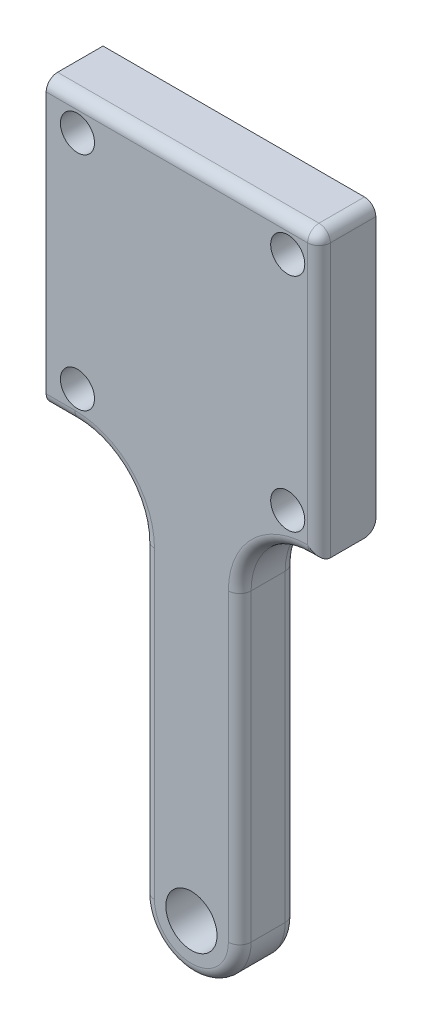
from build123d import *

# Parameters (mm, degrees)
CROQUIS1_R              = 2.2500000000000027
CROQUIS1_R_2            = 1.5000000000000013
CROQUIS1_R_3            = 1.5000000000000009
CROQUIS1_R_4            = 1.4999999999999967
SALIENTE_EXTRUIR1_DEPTH = 5
REDONDEO1_R             = 1


with BuildPart() as part:
    # Croquis1 → Saliente-Extruir1 (new body)
    with BuildSketch(Plane.XY):
        with BuildLine():
            Line((-2.100000000000147, 41.01261693614467), (21.89999999999985, 41.01261693614466))
            Line((21.89999999999985, 41.01261693614466), (21.89999999999985, 16.01261693614466))
            Line((21.89999999999985, 16.01261693614466), (20.92776114455846, 16.01261693614466))
            ThreePointArc((20.92776114455846, 16.01261693614466), (16.68512045743913, 14.255257623263944), (14.927761144558415, 10.012616936144616))
            Line((14.927761144558415, 10.012616936144616), (14.927761144558415, -16.751467205989318))
            ThreePointArc((14.927761144558415, -16.751467205989318), (10.677761144558414, -21.001467205989325), (6.427761144558411, -16.751467205989318))
            Line((6.427761144558411, -16.751467205989318), (6.427761144558411, 10.012616936144616))
            ThreePointArc((6.427761144558411, 10.012616936144616), (4.670401831677697, 14.255257623263944), (0.42776114455836833, 16.01261693614466))
            Line((0.42776114455836833, 16.01261693614466), (-2.100000000000148, 16.01261693614466))
            Line((-2.100000000000148, 16.01261693614466), (-2.100000000000147, 41.01261693614467))
        make_face()
        with Locations((10.677761144558414, -16.751467205989318)):
            Circle(CROQUIS1_R, mode=Mode.SUBTRACT)
        with Locations((0.6499999999998556, 38.26261693614465)):
            Circle(CROQUIS1_R_2, mode=Mode.SUBTRACT)
        with Locations((19.1499999999999, 38.26261693614465)):
            Circle(CROQUIS1_R_3, mode=Mode.SUBTRACT)
        with Locations((19.1499999999999, 18.76261693614465)):
            Circle(CROQUIS1_R_4, mode=Mode.SUBTRACT)
        with Locations((0.6499999999998556, 18.76261693614465)):
            Circle(CROQUIS1_R_2, mode=Mode.SUBTRACT)
    extrude(amount=SALIENTE_EXTRUIR1_DEPTH)

    # Redondeo1
    # the kernel refuses this fillet: 1 mm, written as the material it takes off along each edge
    with BuildSketch(Plane(origin=(20.89999999999985, 40.01261693614466, 4), x_dir=(3e-16, 1, 0), z_dir=(0, 0, 1))) as redondeo1_piece_1_section:
        Polygon((0, 0), (REDONDEO1_R, 0), (REDONDEO1_R, -REDONDEO1_R), (3e-16, -REDONDEO1_R), align=None)
    redondeo1_piece_1 = extrude(amount=REDONDEO1_R, mode=Mode.PRIVATE)
    redondeo1_piece_1 = redondeo1_piece_1 - Plane(origin=(20.89999999999985, 40.01261693614466, 4), x_dir=(-0.7071067811865477, -0.7071067811865475, 0), z_dir=(0, 0, 1)) * Sphere(REDONDEO1_R, mode=Mode.PRIVATE)
    add(redondeo1_piece_1, mode=Mode.SUBTRACT)
    with BuildSketch(Plane(origin=(0.42776114455836833, 16.01261693614466, 0), x_dir=(0, 0, 1), z_dir=(-1, 0, 0))) as redondeo1_piece_2:
        with BuildLine():
            CenterArc((REDONDEO1_R, REDONDEO1_R), REDONDEO1_R, 180, 90)
            Line((-1.1e-16, REDONDEO1_R), (0, 0))
            Line((0, 0), (REDONDEO1_R, 0))
        make_face()
    extrude(amount=5.027761144558516, mode=Mode.SUBTRACT)
    with BuildSketch(Plane(origin=(24.39999999999985, 16.01261693614466, 0), x_dir=(0, 0, 1), z_dir=(-1, 0, 0))) as redondeo1_piece_3:
        with BuildLine():
            CenterArc((REDONDEO1_R, REDONDEO1_R), REDONDEO1_R, 180, 90)
            Line((-1.1e-16, REDONDEO1_R), (0, 0))
            Line((0, 0), (REDONDEO1_R, 0))
        make_face()
    extrude(amount=3.4722388554413897, mode=Mode.SUBTRACT)
    with BuildSketch(Plane(origin=(20.927761144558417, 10.012616936144658, 0), x_dir=(7.11e-15, 1, 0), z_dir=(1, -7.11e-15, 0))) as redondeo1_piece_4:
        with BuildLine():
            CenterArc((6.000000000000002 + REDONDEO1_R, REDONDEO1_R), REDONDEO1_R, 180, 90)
            Line((6.000000000000002 + REDONDEO1_R, -1.1e-16), (6.000000000000002, 0))
            Line((6.000000000000002, 0), (6.000000000000002, REDONDEO1_R))
        make_face()
    revolve(axis=Axis((20.927761144558417, 10.012616936144658, 0), (0, 0, 1)), revolution_arc=90.00000000000081, mode=Mode.SUBTRACT)
    with BuildSketch(Plane(origin=(14.927761144558415, 10.012616936144616, 0), x_dir=(0, 0, 1), z_dir=(0, -1, 0))) as redondeo1_piece_5:
        with BuildLine():
            CenterArc((REDONDEO1_R, REDONDEO1_R), REDONDEO1_R, 180, 90)
            Line((-1.1e-16, REDONDEO1_R), (0, 0))
            Line((0, 0), (REDONDEO1_R, 0))
        make_face()
    extrude(amount=26.76408414213393, mode=Mode.SUBTRACT)
    with BuildSketch(Plane(origin=(10.677761144558414, -16.75146720598932, 0), x_dir=(1, 8.4e-16, 0), z_dir=(-8.4e-16, 1, 0))) as redondeo1_piece_6:
        with BuildLine():
            CenterArc((4.2500000000000036 - REDONDEO1_R, -REDONDEO1_R), REDONDEO1_R, 0, 90)
            Line((4.2500000000000036 - REDONDEO1_R, 1.1e-16), (4.2500000000000036, 0))
            Line((4.2500000000000036, 0), (4.2500000000000036, -REDONDEO1_R))
        make_face()
    revolve(axis=Axis((10.677761144558414, -16.75146720598932, 0), (0, 0, -1)), revolution_arc=180.0000000000001, mode=Mode.SUBTRACT)
    with BuildSketch(Plane(origin=(6.427761144558411, -16.751467205989318, 0), x_dir=(0, 0, 1), z_dir=(0, 1, 0))) as redondeo1_piece_7:
        with BuildLine():
            CenterArc((REDONDEO1_R, REDONDEO1_R), REDONDEO1_R, 180, 90)
            Line((-1.1e-16, REDONDEO1_R), (0, 0))
            Line((0, 0), (REDONDEO1_R, 0))
        make_face()
    extrude(amount=26.76408414213393, mode=Mode.SUBTRACT)
    with BuildSketch(Plane(origin=(0.42776114455836833, 16.01261693614466, 5), x_dir=(0, 0, -1), z_dir=(-1, 0, 0))) as redondeo1_piece_8:
        with BuildLine():
            CenterArc((REDONDEO1_R, -REDONDEO1_R), REDONDEO1_R, 90, 90)
            Line((0, -REDONDEO1_R), (0, 0))
            Line((0, 0), (REDONDEO1_R, 0))
        make_face()
    extrude(amount=5.027761144558516, mode=Mode.SUBTRACT)
    with BuildSketch(Plane(origin=(0.4277611445584084, 10.012616936144658, 5), x_dir=(1, -7.11e-15, 0), z_dir=(-7.11e-15, -1, 0))) as redondeo1_piece_9:
        with BuildLine():
            CenterArc((6.000000000000003 + REDONDEO1_R, -REDONDEO1_R), REDONDEO1_R, 90, 90)
            Line((6.000000000000003 + REDONDEO1_R, 0), (6.000000000000003, 0))
            Line((6.000000000000003, 0), (6.000000000000003, -REDONDEO1_R))
        make_face()
    revolve(axis=Axis((0.4277611445584084, 10.012616936144658, 5), (0, 0, 1)), revolution_arc=90.00000000000078, mode=Mode.SUBTRACT)
    with BuildSketch(Plane(origin=(20.927761144558417, 10.012616936144658, 5), x_dir=(7.11e-15, 1, 0), z_dir=(1, -7.11e-15, 0))) as redondeo1_piece_10:
        with BuildLine():
            CenterArc((6.000000000000002 + REDONDEO1_R, -REDONDEO1_R), REDONDEO1_R, 90, 90)
            Line((6.000000000000002 + REDONDEO1_R, 0), (6.000000000000002, 0))
            Line((6.000000000000002, 0), (6.000000000000002, -REDONDEO1_R))
        make_face()
    revolve(axis=Axis((20.927761144558417, 10.012616936144658, 5), (0, 0, 1)), revolution_arc=90.00000000000081, mode=Mode.SUBTRACT)
    with BuildSketch(Plane(origin=(14.927761144558415, 10.012616936144616, 5), x_dir=(0, 0, -1), z_dir=(0, -1, 0))) as redondeo1_piece_11:
        with BuildLine():
            CenterArc((REDONDEO1_R, -REDONDEO1_R), REDONDEO1_R, 90, 90)
            Line((0, -REDONDEO1_R), (0, 0))
            Line((0, 0), (REDONDEO1_R, 0))
        make_face()
    extrude(amount=26.76408414213393, mode=Mode.SUBTRACT)
    with BuildSketch(Plane(origin=(10.677761144558414, -16.75146720598932, 5), x_dir=(1, 8.4e-16, 0), z_dir=(-8.4e-16, 1, 0))) as redondeo1_piece_12:
        with BuildLine():
            CenterArc((4.2500000000000036 - REDONDEO1_R, REDONDEO1_R), REDONDEO1_R, 270, 90)
            Line((4.2500000000000036 - REDONDEO1_R, 0), (4.2500000000000036, 0))
            Line((4.2500000000000036, 0), (4.2500000000000036, REDONDEO1_R))
        make_face()
    revolve(axis=Axis((10.677761144558414, -16.75146720598932, 5), (0, 0, -1)), revolution_arc=180.0000000000001, mode=Mode.SUBTRACT)
    with BuildSketch(Plane(origin=(0.4277611445584084, 10.012616936144658, 0), x_dir=(1, -7.11e-15, 0), z_dir=(-7.11e-15, -1, 0))) as redondeo1_piece_13:
        with BuildLine():
            CenterArc((6.000000000000003 + REDONDEO1_R, REDONDEO1_R), REDONDEO1_R, 180, 90)
            Line((6.000000000000003 + REDONDEO1_R, -1.1e-16), (6.000000000000003, 0))
            Line((6.000000000000003, 0), (6.000000000000003, REDONDEO1_R))
        make_face()
    revolve(axis=Axis((0.4277611445584084, 10.012616936144658, 0), (0, 0, 1)), revolution_arc=90.00000000000078, mode=Mode.SUBTRACT)
    with BuildSketch(Plane(origin=(21.89999999999985, 41.01261693614466, -2.5), x_dir=(-1, 0, 0), z_dir=(0, 0, 1))) as redondeo1_piece_14:
        with BuildLine():
            CenterArc((REDONDEO1_R, REDONDEO1_R), REDONDEO1_R, 180, 90)
            Line((0, REDONDEO1_R), (0, 0))
            Line((0, 0), (REDONDEO1_R, 0))
        make_face()
    extrude(amount=6.5, mode=Mode.SUBTRACT)
    with BuildSketch(Plane(origin=(-4.600000000000147, 41.01261693614467, 5), x_dir=(0, 0, -1), z_dir=(1, -3e-16, 0))) as redondeo1_piece_15:
        with BuildLine():
            CenterArc((REDONDEO1_R, -REDONDEO1_R), REDONDEO1_R, 90, 90)
            Line((0, -REDONDEO1_R), (0, 0))
            Line((0, 0), (REDONDEO1_R, 0))
        make_face()
    extrude(amount=25.499999999999996, mode=Mode.SUBTRACT)
    with BuildSketch(Plane(origin=(21.89999999999985, 40.01261693614466, 5), x_dir=(0, 0, -1), z_dir=(0, -1, 0))) as redondeo1_piece_16:
        with BuildLine():
            CenterArc((REDONDEO1_R, -REDONDEO1_R), REDONDEO1_R, 90, 90)
            Line((0, -REDONDEO1_R), (0, 0))
            Line((0, 0), (REDONDEO1_R, 0))
        make_face()
    extrude(amount=26.500000000000004, mode=Mode.SUBTRACT)
    with BuildSketch(Plane(origin=(6.427761144558411, -16.751467205989318, 5), x_dir=(0, 0, -1), z_dir=(0, 1, 0))) as redondeo1_piece_17:
        with BuildLine():
            CenterArc((REDONDEO1_R, -REDONDEO1_R), REDONDEO1_R, 90, 90)
            Line((0, -REDONDEO1_R), (0, 0))
            Line((0, 0), (REDONDEO1_R, 0))
        make_face()
    extrude(amount=26.76408414213393, mode=Mode.SUBTRACT)
    with BuildSketch(Plane(origin=(24.39999999999985, 16.01261693614466, 5), x_dir=(0, 0, -1), z_dir=(-1, 0, 0))) as redondeo1_piece_18:
        with BuildLine():
            CenterArc((REDONDEO1_R, -REDONDEO1_R), REDONDEO1_R, 90, 90)
            Line((0, -REDONDEO1_R), (0, 0))
            Line((0, 0), (REDONDEO1_R, 0))
        make_face()
    extrude(amount=3.4722388554413897, mode=Mode.SUBTRACT)


solid = part.part
